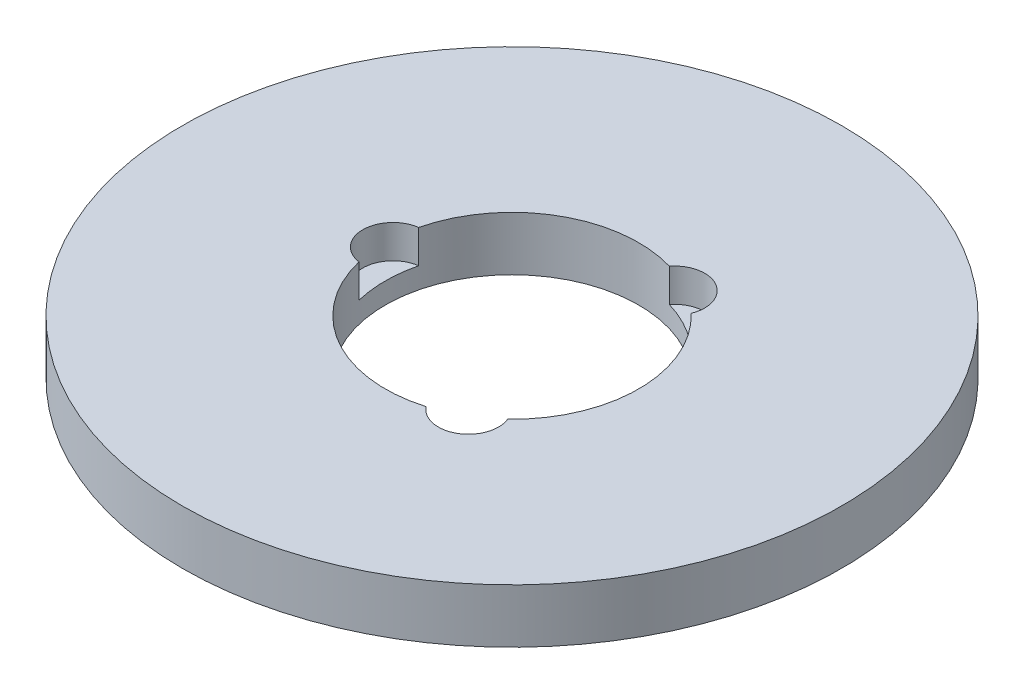
from build123d import *

# Parameters (mm, degrees)
SKETCH1_R           = 97.5
BOSS_EXTRUDE1_DEPTH = 16
SKETCH2_R           = 37.5
CUT_EXTRUDE1_DEPTH  = 139.811022617
SKETCH3_R           = 8.911618978
CUT_EXTRUDE2_DEPTH  = 9.813665753
CIRPATTERN1_COUNT   = 3


with BuildPart() as part:
    # Sketch1 → Boss-Extrude1 (new body)
    with BuildSketch(Plane(origin=(0, 0, 0), x_dir=(1, 0, 0), z_dir=(0, 1, 0))):
        Circle(SKETCH1_R)
    extrude(amount=BOSS_EXTRUDE1_DEPTH)

    # Sketch2 → Cut-Extrude1 (cut, through all)
    with BuildSketch(Plane(origin=(0, 0, 0), x_dir=(1, 0, 0), z_dir=(0, 1, 0))):
        Circle(SKETCH2_R)
    extrude(amount=CUT_EXTRUDE1_DEPTH, mode=Mode.SUBTRACT)

    # Sketch3 → Cut-Extrude2 (cut)
    with BuildSketch(Plane(origin=(0, 16, 0), x_dir=(1, 0, 0), z_dir=(0, 1, 0))):
        with Locations((-35.217234562, 0)):
            Circle(SKETCH3_R)
    cut_extrude2 = extrude(amount=-CUT_EXTRUDE2_DEPTH, mode=Mode.SUBTRACT)

    # CirPattern1: Cut-Extrude2 ×3 about axis
    cirpattern1_axis = Axis((0, 0, 0), (0, 1, 0))
    for i in range(1, CIRPATTERN1_COUNT):
        add(cut_extrude2.rotate(cirpattern1_axis, i * 360 / CIRPATTERN1_COUNT), mode=Mode.SUBTRACT)


solid = part.part
